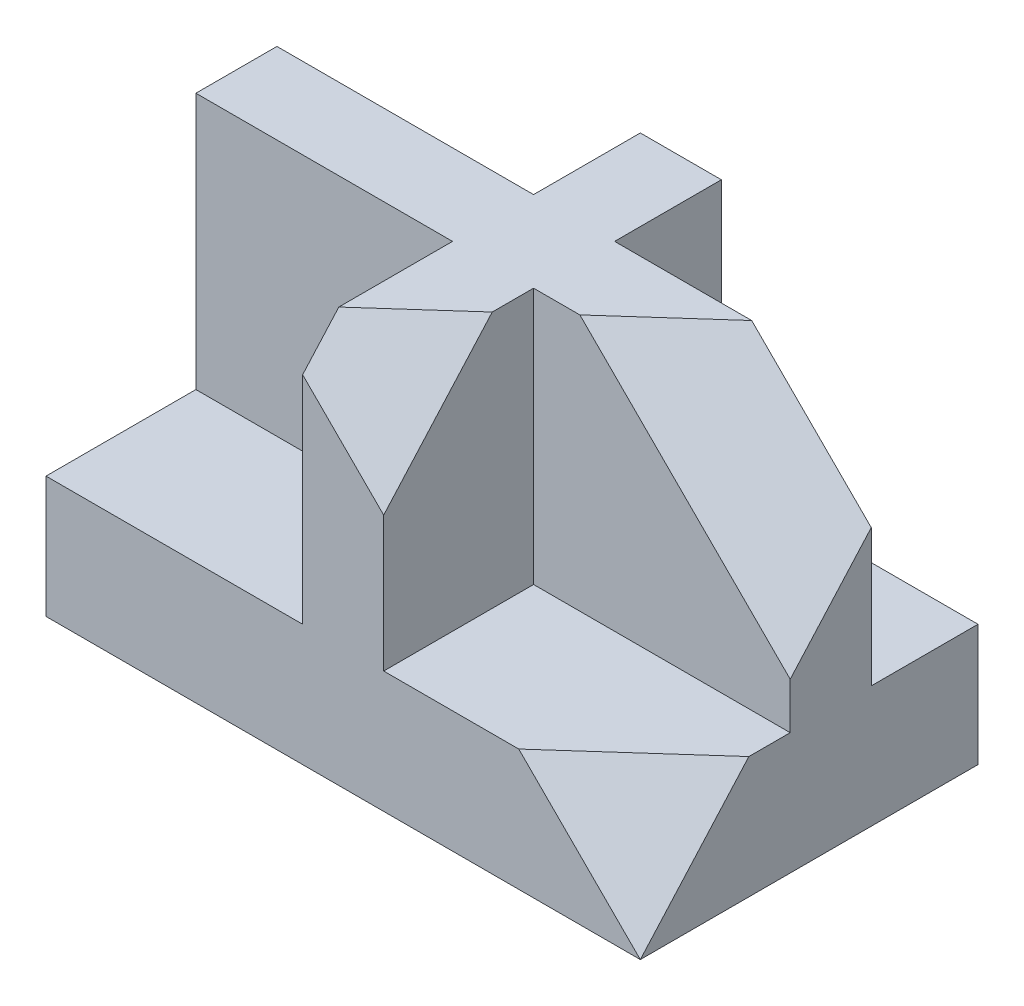
from build123d import *

# Parameters (mm, degrees)
SKETCH1_W           = 88
SKETCH1_H           = 50
BOSS_EXTRUDE1_DEPTH = 18
BOSS_EXTRUDE2_DEPTH = 38
CUT_EXTRUDE1_DEPTH  = 58


with BuildPart() as part:
    # Sketch1 → Boss-Extrude1 (new body)
    with BuildSketch(Plane(origin=(0, 0, 0), x_dir=(1, 0, 0), z_dir=(0, 1, 0))):
        with Locations((2.861271676, 0.624277457)):
            Rectangle(SKETCH1_W, SKETCH1_H)
    extrude(amount=BOSS_EXTRUDE1_DEPTH)

    # Sketch2 → Boss-Extrude2 (add)
    with BuildSketch(Plane(origin=(0, 18, 0), x_dir=(1, 0, 0), z_dir=(0, 1, 0))):
        Polygon((-41.138728324, 9.818170447), (-3.138728324, 9.818170447), (-3.138728324, 25.624277457), (8.861271676, 25.624277457), (8.861271676, 9.818170447), (46.861271676, 9.818170447), (46.861271676, -2.181829553), (8.861271676, -2.181829553), (8.861271676, -24.375722543), (-3.138728324, -24.375722543), (-3.138728324, -2.181829553), (-41.138728324, -2.181829553), align=None)
    extrude(amount=BOSS_EXTRUDE2_DEPTH)

    # Sketch5 → Cut-Extrude1 (cut)
    with BuildSketch(Plane(origin=(22.788250038, 22.788250038, 25.522840043), x_dir=(-0.8323002445923469, 0.36918924973045525, 0.4134919596981098), z_dir=(-0.5543250876981122, -0.5543250876981184, -0.6208440982218917))):
        Polygon((-28.923482595, -16.234615602), (38.359929087, 25.537893449), (-28.923482595, 58.838681914), align=None)
    extrude(amount=-CUT_EXTRUDE1_DEPTH, mode=Mode.SUBTRACT)


solid = part.part
